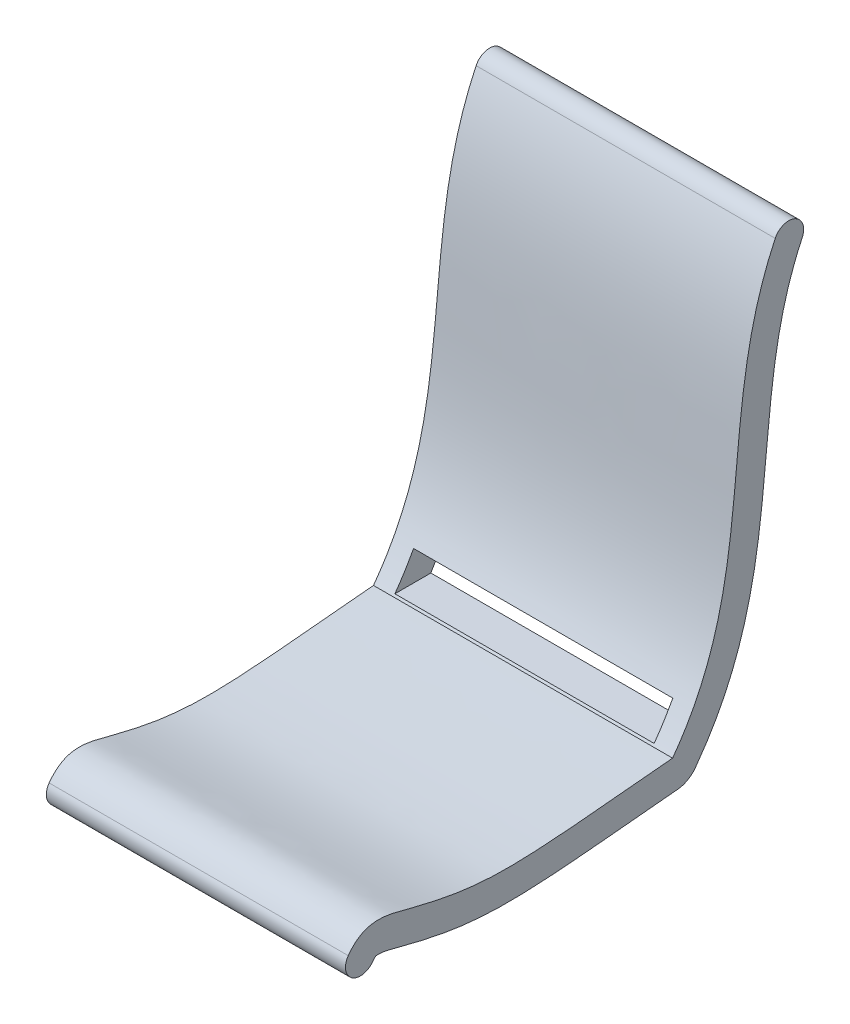
from build123d import *

# Parameters (mm, degrees)
BOSS_EXTRUDE1_DEPTH = 15
SKETCH9_W           = 26
SKETCH9_H           = 3
CUT_EXTRUDE4_DEPTH  = 5


with BuildPart() as part:
    # Sketch1 → Boss-Extrude1 (new, symmetric)
    with BuildSketch(Plane(origin=(0, 0, 0), x_dir=(0, 0, -1), z_dir=(1, 0, 0))):
        with BuildLine():
            ThreePointArc((9.036011554, 19.450956622), (11.035362162, 20.159897485), (11.744303025, 18.160546877))
            add(Edge.make_bspline(
                [(1.157770356, -22.329473829), (1.463611148, -21.914703974), (2.05754771, -21.062463733), (3.121702365, -19.349051685), (4.256040126, -17.16210706), (5.331318901, -14.500204203), (6.440778732, -10.923662964), (7.326648655, -6.444578728), (8.128169591, 0.627149111), (8.783438471, 9.151627527), (10.372352083, 15.281118038), (11.744303025, 18.160546877)],
                knots=[0, 0, 0, 0, 0.03125, 0.0625, 0.125, 0.1875, 0.25, 0.375, 0.5, 0.75, 1, 1, 1, 1], degree=3))
            ThreePointArc((1.157770356, -22.329473829), (0.24597488, -23.207173756), (-0.976184075, -23.535891935))
            add(Edge.make_bspline(
                [(-0.976184075, -23.535891935), (-1.554489187, -23.59022068), (-2.736770247, -23.702081912), (-4.895227122, -23.908012313), (-7.369724773, -24.144363283), (-9.989551637, -24.385401412), (-13.105931468, -24.645102137), (-16.426584927, -24.841144857), (-19.922305825, -24.81728618), (-22.708408769, -24.527747164), (-24.996526943, -24.122373436), (-26.49032013, -23.795782138), (-27.737140522, -23.492419024), (-28.731147452, -23.236602738), (-29.682919951, -22.980075657), (-30.407566932, -22.835823889), (-30.877035791, -22.820633735), (-31.002814813, -22.855496511), (-31.041204407, -22.872189034), (-31.086678043, -22.898747288), (-31.168328291, -22.968575035), (-31.261014331, -23.071160967), (-31.323136616, -23.151744387), (-31.350418901, -23.189717133)],
                knots=[0, 0, 0, 0, 0.03125, 0.0625, 0.125, 0.1875, 0.25, 0.375, 0.5, 0.625, 0.6875, 0.75, 0.78125, 0.8125, 0.84375, 0.875, 0.90625, 0.9375, 0.953125, 0.96875, 0.984375, 0.9921875, 1, 1, 1, 1], degree=3))
            ThreePointArc((-31.350418901, -23.189717133), (-33.443832772, -23.532672474), (-33.786788112, -21.439258603))
            add(Edge.make_bspline(
                [(-1.256782897, -20.549043378), (-16.838959626, -22.0129075), (-20.229992628, -22.662526335), (-32.151832307, -19.16365143), (-33.786788112, -21.439258603)],
                knots=[0, 0, 0, 0, 0.814502421, 1, 1, 1, 1], degree=3))
            add(Edge.make_bspline(
                [(-1.256782897, -20.549043378), (7.624357581, -8.504772498), (2.902316133, 6.577654122), (9.036011554, 19.450956622)],
                knots=[0, 0, 0, 0, 1, 1, 1, 1], degree=3))
        make_face()
    extrude(amount=BOSS_EXTRUDE1_DEPTH, both=True)

    # Sketch9 → Cut-Extrude4 (cut, symmetric)
    with BuildSketch(Plane.XY):
        with Locations((0, -18.847100542)):
            Rectangle(SKETCH9_W, SKETCH9_H)
    cut_extrude4 = extrude(amount=CUT_EXTRUDE4_DEPTH, both=True, mode=Mode.SUBTRACT)

    # Mirror1: Cut-Extrude4 across plane
    add(cut_extrude4.mirror(Plane(origin=(0, 0, 0), x_dir=(0, 0, 1), z_dir=(1, 0, 0))), mode=Mode.SUBTRACT)


solid = part.part
